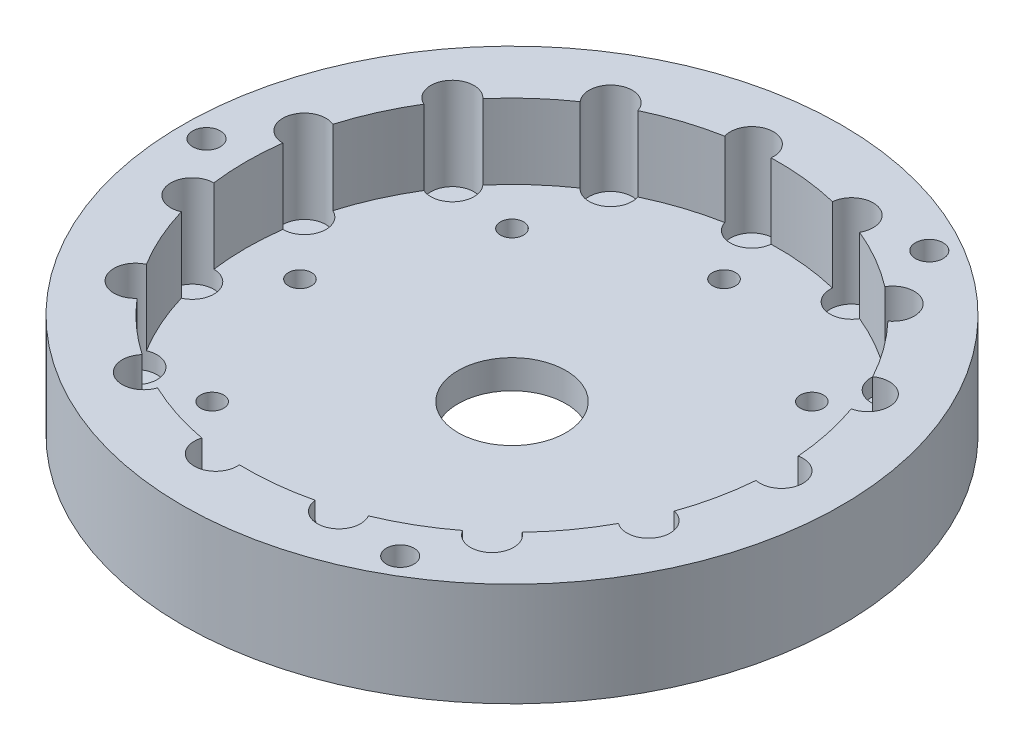
from build123d import *

# Parameters (mm, degrees)
SKETCH1_R           = 45.85
SKETCH1_R_2         = 1.5635
SKETCH1_R_3         = 7.5
BOSS_EXTRUDE1_DEPTH = 4
SKETCH1_6_R         = 3
SKETCH1_6_R_2       = 1.607
CUT_EXTRUDE1_DEPTH  = 2.4105
BOSS_EXTRUDE2_START = 10.4105
SKETCH1_7_R         = 45.85
SKETCH1_7_R_2       = 1.5635
BOSS_EXTRUDE2_DEPTH = 10.4105
SKETCH2_R           = 1.925
CUT_EXTRUDE2_DEPTH  = 4


with BuildPart() as part:
    # Sketch1 → Boss-Extrude1 (new body)
    with BuildSketch(Plane(origin=(0, 0, 0), x_dir=(1, 0, 0), z_dir=(0, 1, 0))):
        Circle(SKETCH1_R)
        with Locations((-42.5, 0)):
            Circle(SKETCH1_R_2, mode=Mode.SUBTRACT)
        with Locations((21.25, -36.806079661)):
            Circle(SKETCH1_R_2, mode=Mode.SUBTRACT)
        with Locations((21.25, 36.806079661)):
            Circle(SKETCH1_R_2, mode=Mode.SUBTRACT)
        Circle(SKETCH1_R_3, mode=Mode.SUBTRACT)
    extrude(amount=-BOSS_EXTRUDE1_DEPTH)

    # Sketch1<6> → Cut-Extrude1 (cut)
    with BuildSketch(Plane(origin=(0, 0, 0), x_dir=(1, 0, 0), z_dir=(0, 1, 0))):
        with Locations((37.5, 0)):
            Circle(SKETCH1_6_R)
        with Locations((34.257954662, 15.252624115)):
            Circle(SKETCH1_6_R)
        with Locations((34.257954662, -15.252624115)):
            Circle(SKETCH1_6_R)
        with Locations((25.092397738, 27.867930955)):
            Circle(SKETCH1_6_R)
        with Locations((25.092397738, -27.867930955)):
            Circle(SKETCH1_6_R)
        with Locations((11.588137289, 35.664619361)):
            Circle(SKETCH1_6_R)
        with Locations((11.588137289, -35.664619361)):
            Circle(SKETCH1_6_R)
        with Locations((-3.919817373, 37.294571076)):
            Circle(SKETCH1_6_R)
        with Locations((-3.919817373, -37.294571076)):
            Circle(SKETCH1_6_R)
        with Locations((-18.75, 32.475952642)):
            Circle(SKETCH1_6_R)
        with Locations((-18.75, -32.475952642)):
            Circle(SKETCH1_6_R)
        with Locations((-30.338137289, 22.041946961)):
            Circle(SKETCH1_6_R)
        with Locations((-30.338137289, -22.041946961)):
            Circle(SKETCH1_6_R)
        with Locations((-36.680535028, 7.796688406)):
            Circle(SKETCH1_6_R)
        with Locations((-36.680535028, -7.796688406)):
            Circle(SKETCH1_6_R)
        with Locations((29.5, 0)):
            Circle(SKETCH1_6_R_2)
        with Locations((20.859650045, -20.859650045)):
            Circle(SKETCH1_6_R_2)
        with Locations((0, -29.5)):
            Circle(SKETCH1_6_R_2)
        with Locations((-20.859650045, -20.859650045)):
            Circle(SKETCH1_6_R_2)
        with Locations((-29.5, 0)):
            Circle(SKETCH1_6_R_2)
        with Locations((-20.859650045, 20.859650045)):
            Circle(SKETCH1_6_R_2)
        with Locations((0, 29.5)):
            Circle(SKETCH1_6_R_2)
        with Locations((20.859650045, 20.859650045)):
            Circle(SKETCH1_6_R_2)
    extrude(amount=-CUT_EXTRUDE1_DEPTH, mode=Mode.SUBTRACT)

    # Sketch1<7> → Boss-Extrude2 (add)
    with BuildSketch(Plane(origin=(0, 0, 0), x_dir=(1, 0, 0), z_dir=(0, 1, 0)).offset(BOSS_EXTRUDE2_START)):
        Circle(SKETCH1_7_R)
        with Locations((-42.5, 0)):
            Circle(SKETCH1_7_R_2, mode=Mode.SUBTRACT)
        with Locations((21.25, -36.806079661)):
            Circle(SKETCH1_7_R_2, mode=Mode.SUBTRACT)
        with BuildLine():
            ThreePointArc((36.883333333, 2.935936345), (39.39076704, 2.32916294), (40.5, 0))
            ThreePointArc((40.5, 0), (39.39076704, -2.32916294), (36.883333333, -2.935936345))
            ThreePointArc((36.883333333, -2.935936345), (36.191461227, -7.69273256), (34.888754523, -12.319691873))
            ThreePointArc((34.888754523, -12.319691873), (36.59166411, -13.367471546), (37.257954662, -15.252624115))
            ThreePointArc((37.257954662, -15.252624115), (35.6231437, -17.924001829), (32.500448736, -17.683914497))
            ThreePointArc((32.500448736, -17.683914497), (29.933628792, -21.748054335), (26.861593101, -25.445133446))
            ThreePointArc((26.861593101, -25.445133446), (27.767055295, -26.50917897), (28.092397738, -27.867930955))
            ThreePointArc((28.092397738, -27.867930955), (25.872343464, -30.764771418), (22.497941295, -29.37418318))
            ThreePointArc((22.497941295, -29.37418318), (18.5, -32.04293994), (14.189818202, -34.170880284))
            ThreePointArc((14.189818202, -34.170880284), (14.486847583, -34.891651942), (14.588137289, -35.664619361))
            ThreePointArc((14.588137289, -35.664619361), (11.748752331, -38.660316744), (8.605335417, -35.985388734))
            ThreePointArc((8.605335417, -35.985388734), (3.867553141, -36.797310129), (-0.935505175, -36.988171489))
            ThreePointArc((-0.935505175, -36.988171489), (-0.92374189, -37.141170608), (-0.919817373, -37.294571076))
            ThreePointArc((-0.919817373, -37.294571076), (-4.385552663, -40.258199029), (-6.775211132, -36.37439366))
            ThreePointArc((-6.775211132, -36.37439366), (-11.433628792, -35.189091103), (-15.899071208, -33.409871815))
            ThreePointArc((-15.899071208, -33.409871815), (-20.25, -35.074028853), (-20.984262125, -30.47393547))
            ThreePointArc((-20.984262125, -30.47393547), (-24.757832435, -27.496358543), (-28.113543391, -24.054701786))
            ThreePointArc((-28.113543391, -24.054701786), (-32.765188272, -23.805302718), (-31.564943561, -19.304256991))
            ThreePointArc((-31.564943561, -19.304256991), (-33.801181933, -15.049255794), (-35.466928517, -10.540255288))
            ThreePointArc((-35.466928517, -10.540255288), (-39.61497783, -8.420423478), (-36.687759497, -4.796697105))
            ThreePointArc((-36.687759497, -4.796697105), (-37, 0), (-36.687759497, 4.796697105))
            ThreePointArc((-36.687759497, 4.796697105), (-39.61497783, 8.420423478), (-35.466928517, 10.540255288))
            ThreePointArc((-35.466928517, 10.540255288), (-33.801181933, 15.049255794), (-31.564943561, 19.304256991))
            ThreePointArc((-31.564943561, 19.304256991), (-32.765188272, 23.805302718), (-28.113543391, 24.054701786))
            ThreePointArc((-28.113543391, 24.054701786), (-24.757832435, 27.496358543), (-20.984262125, 30.47393547))
            ThreePointArc((-20.984262125, 30.47393547), (-20.25, 35.074028853), (-15.899071208, 33.409871815))
            ThreePointArc((-15.899071208, 33.409871815), (-11.433628792, 35.189091103), (-6.775211132, 36.37439366))
            ThreePointArc((-6.775211132, 36.37439366), (-4.385552663, 40.258199029), (-0.919817373, 37.294571076))
            ThreePointArc((-0.919817373, 37.294571076), (-0.92374189, 37.141170608), (-0.935505175, 36.988171489))
            ThreePointArc((-0.935505175, 36.988171489), (3.867553141, 36.797310129), (8.605335417, 35.985388734))
            ThreePointArc((8.605335417, 35.985388734), (11.748752331, 38.660316744), (14.588137289, 35.664619361))
            ThreePointArc((14.588137289, 35.664619361), (14.486847583, 34.891651942), (14.189818202, 34.170880284))
            ThreePointArc((14.189818202, 34.170880284), (18.5, 32.04293994), (22.497941295, 29.37418318))
            ThreePointArc((22.497941295, 29.37418318), (25.872343464, 30.764771418), (28.092397738, 27.867930955))
            ThreePointArc((28.092397738, 27.867930955), (27.767055295, 26.50917897), (26.861593101, 25.445133446))
            ThreePointArc((26.861593101, 25.445133446), (29.933628792, 21.748054335), (32.500448736, 17.683914497))
            ThreePointArc((32.500448736, 17.683914497), (35.6231437, 17.924001829), (37.257954662, 15.252624115))
            ThreePointArc((37.257954662, 15.252624115), (36.59166411, 13.367471546), (34.888754523, 12.319691873))
            ThreePointArc((34.888754523, 12.319691873), (36.191461227, 7.69273256), (36.883333333, 2.935936345))
        make_face(mode=Mode.SUBTRACT)
        with Locations((21.25, 36.806079661)):
            Circle(SKETCH1_7_R_2, mode=Mode.SUBTRACT)
    extrude(amount=-BOSS_EXTRUDE2_DEPTH)

    # Sketch2 → Cut-Extrude2 (cut)
    with BuildSketch(Plane(origin=(0, 10.4105, 0), x_dir=(1, 0, 0), z_dir=(0, 1, 0))):
        with Locations((-42.5, 0)):
            Circle(SKETCH2_R)
        with Locations((21.25, 36.806079661)):
            Circle(SKETCH2_R)
        with Locations((21.25, -36.806079661)):
            Circle(SKETCH2_R)
    extrude(amount=-CUT_EXTRUDE2_DEPTH, mode=Mode.SUBTRACT)


solid = part.part
